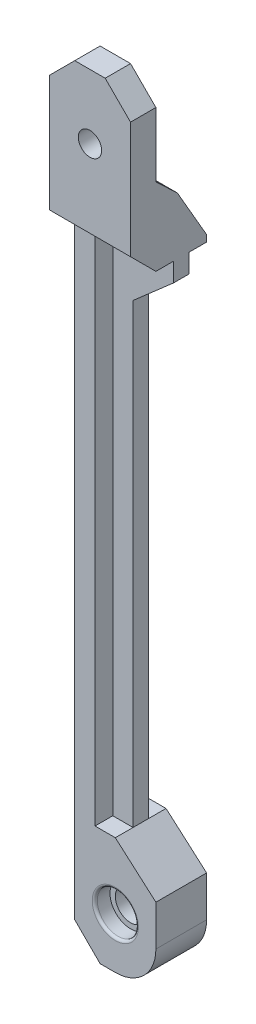
from build123d import *

# Parameters (mm, degrees)
SKETCH_1_R               = 4.05
EXTRUDE_1_DEPTH          = 10
SKETCH_2_W               = 16
SKETCH_2_H               = 27.984210489
EXTRUDE_2_DEPTH          = 5
SKETCH_3_R               = 2.3
CUT_EXTRUDE_1_DEPTH      = 5
CHAMFER_2_SIZE           = 5
CHAMFER_3_SIZE           = 10
CHAMFER_3_SIZE2          = 5.773502692
EXTRUDE_3_DEPTH          = 3
CHAMFER_5_SIZE           = 5
CHAMFER_6_SIZE           = 5
FILLET_1_R               = 8
CUT_EXTRUDE_3_DEPTH      = 20
CUT_EXTRUDE_3_DEPTH_BACK = 4
SKETCH_7_W               = 3.5
SKETCH_7_H               = 100.709566722
EXTRUDE_4_DEPTH          = 2
EXTRUDE_4_DEPTH_BACK     = 2
SKETCH_8_R               = 4.05
SKETCH_8_R_2             = 3
FILLET_2_R               = 0.5


with BuildPart() as part:
    # 草图1 → 凸台-拉伸1 (new body)
    with BuildSketch(Plane.XY):
        Polygon((-8, -77.5), (8, -77.5), (8, -61.5), (0, -54.489879842), (0, 35.510120158), (8, 42.5), (8, 57.5), (-8, 57.5), (-8, 42.5), (-8, -61.5), align=None)
        with Locations((0, -67.5)):
            Circle(SKETCH_1_R, mode=Mode.SUBTRACT)
    extrude(amount=EXTRUDE_1_DEPTH)

    # 草图2 → 凸台-拉伸2 (add)
    with BuildSketch(Plane.XY.offset(10)):
        with Locations((0, 65.211792125)):
            Rectangle(SKETCH_2_W, SKETCH_2_H)
    extrude(amount=EXTRUDE_2_DEPTH)

    # 草图3 → 切除-拉伸1 (cut)
    with BuildSketch(Plane.XY.offset(15)):
        with Locations((0, 66.5)):
            Circle(SKETCH_3_R)
    extrude(amount=-CUT_EXTRUDE_1_DEPTH, mode=Mode.SUBTRACT)

    # 倒角2
    chamfer_2_edges = [part.edges().sort_by_distance(p)[0] for p in [
        (0, 51.21968688, 10),
    ]]
    chamfer(chamfer_2_edges, length=CHAMFER_2_SIZE - 0.0001)  # a hair under: the kernel refuses the full size

    # 倒角3
    chamfer_3_edges = [part.edges().sort_by_distance(p)[0] for p in [
        (0, 57.5, 0),
    ]]
    chamfer_3_side = [part.faces().sort_by_distance(p)[0] for p in [
        (-2.385544593, -8.070394636, 0),
    ]]
    chamfer(chamfer_3_edges, length=CHAMFER_3_SIZE, length2=CHAMFER_3_SIZE2, reference=chamfer_3_side[0])

    # 草图5 → 凸台-拉伸3 (add)
    with BuildSketch(Plane(origin=(8, 0, 0), x_dir=(0, 0, -1), z_dir=(1, 0, 0))):
        Polygon((-10, 61.5), (-5.773502692, 57.5), (-10, 57.5), align=None)
    extrude_3 = extrude(amount=-EXTRUDE_3_DEPTH)

    # 镜向1: 凸台-拉伸3 across plane
    add(extrude_3.mirror(Plane(origin=(0, 0, 0), x_dir=(0, 0, 1), z_dir=(1, 0, 0))))

    # 倒角5
    chamfer_5_edges = [part.edges().sort_by_distance(p)[0] for p in [
        (-8, 79.203897369, 12.5),
        (8, 79.203897369, 12.5),
    ]]
    chamfer(chamfer_5_edges, length=CHAMFER_5_SIZE)

    # 倒角6
    chamfer_6_edges = [part.edges().sort_by_distance(p)[0] for p in [
        (-8, -77.5, 5),
    ]]
    chamfer(chamfer_6_edges, length=CHAMFER_6_SIZE)

    # 圆角1
    fillet_1_edges = [part.edges().sort_by_distance(p)[0] for p in [
        (8, -77.5, 5),
    ]]
    fillet(fillet_1_edges, radius=FILLET_1_R)

    # 草图7 → 切除-拉伸3 (cut, two sides: drawn at the far end of the back side and taken through both)
    with BuildSketch(Plane(origin=(0, 0, 0), x_dir=(0, 0, -1), z_dir=(1, 0, 0)).offset(-CUT_EXTRUDE_3_DEPTH_BACK)):
        with Locations((-1.75, -4.135096481)):
            Rectangle(SKETCH_7_W, SKETCH_7_H)
        with Locations((-8.25, -4.135096481)):
            Rectangle(SKETCH_7_W, SKETCH_7_H)
    extrude(amount=CUT_EXTRUDE_3_DEPTH + CUT_EXTRUDE_3_DEPTH_BACK, mode=Mode.SUBTRACT)

    # 草图8 → 凸台-拉伸4 (add, two sides: drawn at the far end of the back side and taken through both)
    with BuildSketch(Plane.XY.offset(5).offset(-EXTRUDE_4_DEPTH_BACK)):
        with Locations((0, -67.5)):
            Circle(SKETCH_8_R)
        with Locations((0, -67.5)):
            Circle(SKETCH_8_R_2, mode=Mode.SUBTRACT)
    extrude(amount=EXTRUDE_4_DEPTH + EXTRUDE_4_DEPTH_BACK)

    # 圆角2
    fillet_2_edges = [part.edges().sort_by_distance(p)[0] for p in [
        (-4.05, -67.5, 0),
        (-4.05, -67.5, 10),
    ]]
    fillet(fillet_2_edges, radius=FILLET_2_R)


solid = part.part
